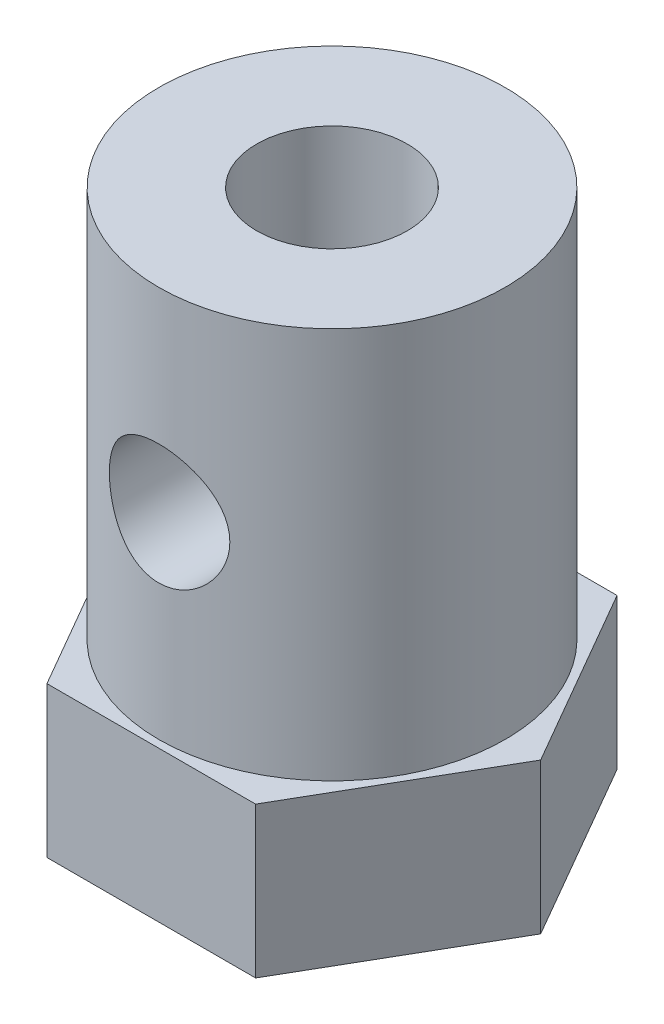
from build123d import *

# Parameters (mm, degrees)
EXTRUDE_1_DEPTH          = 5
SKETCH_2_R               = 5.75
EXTRUDE_2_DEPTH          = 13
SKETCH_4_R               = 2
CUT_EXTRUDE_2_DEPTH      = 5
THREAD_1_PITCH           = 0.3175
SKETCH_11_R              = 2.5
CUT_EXTRUDE_3_DEPTH      = 13
CUT_EXTRUDE_5_DEPTH      = 13
CUT_EXTRUDE_5_DEPTH_BACK = 13
SKETCH_12_R              = 2


with BuildPart() as part:
    # Sketch 1 → 凸台-拉伸1 (new body)
    with BuildSketch(Plane(origin=(0, 0, 0), x_dir=(1, 0, 0), z_dir=(0, 1, 0))):
        Polygon((6.92820323, 0), (3.464101615, 6), (-3.464101615, 6), (-6.92820323, 0), (-3.464101615, -6), (3.464101615, -6), align=None)
    extrude(amount=EXTRUDE_1_DEPTH)

    # 草图2 → 凸台-拉伸2 (add)
    with BuildSketch(Plane(origin=(0, 5, 0), x_dir=(1, 0, 0), z_dir=(0, 1, 0))):
        with Locations(Location((0, 0, 0), (0, 0, 90))):
            Circle(SKETCH_2_R)
    extrude(amount=EXTRUDE_2_DEPTH)

    # 草图4 → 切除-拉伸2 (cut)
    with BuildSketch(Plane(origin=(0, 0, 0), x_dir=(-1, 0, 0), z_dir=(0, -1, 0))):
        with Locations(Location((0, 0, 0), (0, 0, 90))):
            Circle(SKETCH_4_R)
    extrude(amount=-CUT_EXTRUDE_2_DEPTH, mode=Mode.SUBTRACT)

    # 螺纹线1: the profile of Sketch 1 2 profile screwed along a right-hand helix of 15.748031 turns, 6 arcs to a turn; built about Z, then put on its axis
    thread_1_z = Axis((0, 0, 0), (0, 0, 1))
    thread_1_corners = [(2.0003, 0, -0.000173205), (2.0003, 0, 0.277985704), (1.828148085, 0, 0.17859375), (1.828148085, 0, 0.09921875)]
    with BuildLine(mode=Mode.PRIVATE) as thread_1_profile:
        Line(thread_1_corners[0], thread_1_corners[1])
        Line(thread_1_corners[1], thread_1_corners[2])
        Line(thread_1_corners[2], thread_1_corners[3])
        Line(thread_1_corners[3], thread_1_corners[0])
    thread_1_cap = Face(thread_1_profile.wire())
    thread_1_turn_angles = [0, 30, 60, 90, 120, 150, 180, 210, 240, 270, 300, 330, 360]
    thread_1_turn_weights = [1, 0.8660254037844387, 1, 0.8660254037844387, 1, 0.8660254037844387, 1, 0.8660254037844387, 1, 0.8660254037844387, 1, 0.8660254037844387, 1]
    thread_1_turn_rails = [Edge.make_bspline([Vector(p[0], p[1], 0).rotate(thread_1_z, thread_1_turn_angles[k]) / thread_1_turn_weights[k] + Vector(0, 0, p[2] + THREAD_1_PITCH * thread_1_turn_angles[k] / 360) for k in range(13)], [0, 0, 0, 1, 1, 2, 2, 3, 3, 4, 4, 5, 5, 6, 6, 6], 2, thread_1_turn_weights) for p in thread_1_corners]
    thread_1_turn_sides = [Face.make_surface_from_curves(thread_1_turn_rails[p[0]], thread_1_turn_rails[p[1]]) for p in [(0, 1), (1, 2), (2, 3), (3, 0)]]
    thread_1_last_angles = [5400, 5430, 5460, 5490, 5520, 5550, 5580, 5610, 5640, 5654.645669291, 5669.291338583]
    thread_1_last_weights = [1, 0.8660254037844387, 1, 0.8660254037844387, 1, 0.8660254037844387, 1, 0.8660254037844387, 1, 0.9675079437748935, 1]
    thread_1_last_rails = [Edge.make_bspline([Vector(p[0], p[1], 0).rotate(thread_1_z, thread_1_last_angles[k]) / thread_1_last_weights[k] + Vector(0, 0, p[2] + THREAD_1_PITCH * thread_1_last_angles[k] / 360) for k in range(11)], [0, 0, 0, 1, 1, 2, 2, 3, 3, 4, 4, 5, 5, 5], 2, thread_1_last_weights) for p in thread_1_corners]
    thread_1_last_sides = [Face.make_surface_from_curves(thread_1_last_rails[p[0]], thread_1_last_rails[p[1]]) for p in [(0, 1), (1, 2), (2, 3), (3, 0)]]
    thread_1 = Plane(origin=(0, 0, 0), x_dir=(1, 0, 0), z_dir=(0, 1, 0)) * Solid(Shell([*[p.moved(Location((0, 0, THREAD_1_PITCH * i))) for i in range(15) for p in thread_1_turn_sides], *thread_1_last_sides, thread_1_cap, thread_1_cap.rotate(thread_1_z, 5669.291338583).moved(Location((0, 0, THREAD_1_PITCH * 5669.291338583 / 360)))]))
    add(thread_1)

    # 草图11 → 切除-拉伸3 (cut)
    with BuildSketch(Plane(origin=(0, 18, 0), x_dir=(1, 0, 0), z_dir=(0, 1, 0))):
        with Locations(Location((0, 0, 0), (0, 0, 270))):
            Circle(SKETCH_11_R)
    extrude(amount=-CUT_EXTRUDE_3_DEPTH, mode=Mode.SUBTRACT)

    # 草图12 → 切除-拉伸5 (cut, two sides: drawn at the far end of the back side and taken through both)
    with BuildSketch(Plane.XY.offset(-CUT_EXTRUDE_5_DEPTH_BACK)):
        with Locations(Location((0, 11.5, 0), (0, 0, 180))):
            Circle(SKETCH_12_R)
    extrude(amount=CUT_EXTRUDE_5_DEPTH + CUT_EXTRUDE_5_DEPTH_BACK, mode=Mode.SUBTRACT)


solid = part.part
